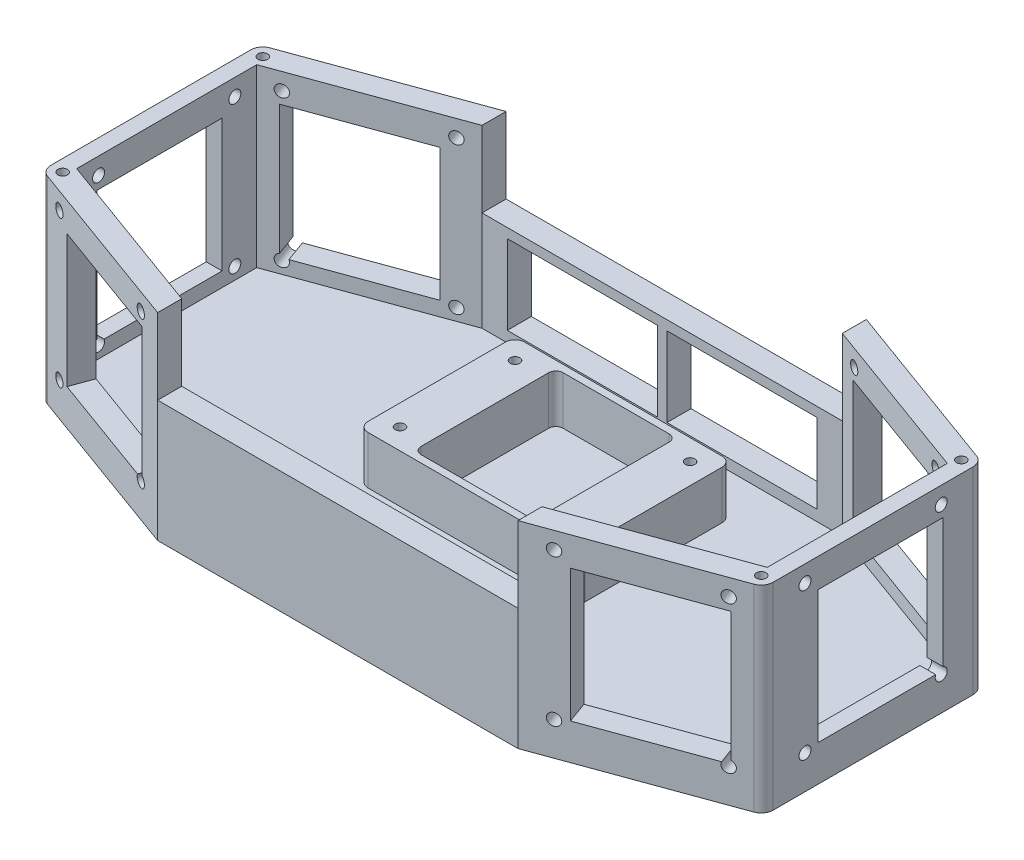
from build123d import *

# Parameters (mm, degrees)
BOSS_EXTRUDE1_DEPTH     = 8
SKETCH2_W               = 10.5
SKETCH2_H               = 10
BOSS_EXTRUDE2_DEPTH     = 37.5
SKETCH4_W               = 128.649180674
SKETCH4_H               = 10
BOSS_EXTRUDE4_DEPTH     = 4.5
BOSS_EXTRUDE5_DEPTH     = 10
SKETCH6_W               = 149.649180674
SKETCH6_H               = 10
BOSS_EXTRUDE6_DEPTH     = 4
CUT_EXTRUDE1_REACH      = 249.54
SKETCH7_R               = 2.5
MIRROR2_COPY_1_REACH    = 249.54
MIRROR2_COPY_1_SKETCH_R = 2.5
CUT_EXTRUDE2_REACH      = 314.548
SKETCH8_R               = 2.5
BOSS_EXTRUDE8_DEPTH     = 63
CUT_EXTRUDE3_REACH      = 257.708
SKETCH10_R              = 2.5
MIRROR5_COPY_1_REACH    = 257.708
MIRROR5_COPY_1_SKETCH_R = 2.5
CUT_EXTRUDE4_REACH      = 321.057
SKETCH11_R              = 2.5
SKETCH12_W              = 6.577848346
SKETCH12_H              = 46
BOSS_EXTRUDE9_DEPTH     = 12
BOSS_EXTRUDE10_DEPTH    = 20
SKETCH14_R              = 2
CUT_EXTRUDE5_DEPTH      = 10
SKETCH15_W              = 149.649180674
SKETCH15_H              = 10
BOSS_EXTRUDE11_DEPTH    = 41.5
SKETCH17_R              = 2
CUT_EXTRUDE6_DEPTH      = 10
ENL_V_START             = -2
ESQUISSE1_W             = 12
ESQUISSE1_H             = 42
ESQUISSE1_W_2           = 42
ESQUISSE1_H_2           = 12
ENL_V_MAT_EXTRU_1_DEPTH = 6
BOSS_EXTRU_1_DEPTH      = 1
CONG_1_R                = 5
ENL_V_MAT_EXTRU_2_DEPTH = 10
ESQUISSE5_W             = 52
ESQUISSE5_H             = 55
ENL_V_MAT_EXTRU_3_DEPTH = 10
ESQUISSE6_W             = 52
ESQUISSE6_H             = 55
ENL_V_MAT_EXTRU_4_DEPTH = 10
ESQUISSE7_W             = 52
ESQUISSE7_H             = 55
ENL_V_MAT_EXTRU_5_DEPTH = 10
ESQUISSE8_W             = 52
ESQUISSE8_H             = 55
ENL_V_MAT_EXTRU_6_DEPTH = 10
ESQUISSE9_W             = 52
ESQUISSE9_H             = 55
ENL_V_MAT_EXTRU_7_DEPTH = 10
BOSS_EXTRU_2_REACH      = 182.079
ESQUISSE11_W            = 4
ESQUISSE11_H            = 10


with BuildPart() as part:
    # Sketch1 → Boss-Extrude1 (new body)
    with BuildSketch(Plane(origin=(0, 0, 0), x_dir=(1, 0, 0), z_dir=(0, 1, 0))):
        Polygon((-150, 45), (-150, -45), (-74.824590337, -72.361611466), (74.824590337, -72.361611466), (150, -45), (150, 45), (74.824590337, 72.361611466), (-74.824590337, 72.361611466), align=None)
    extrude(amount=BOSS_EXTRUDE1_DEPTH)

    # Sketch2 → Boss-Extrude2 (add)
    with BuildSketch(Plane(origin=(0, 8, 0), x_dir=(1, 0, 0), z_dir=(0, 1, 0))):
        with Locations((69.574590337, 67.361611466)):
            Rectangle(SKETCH2_W, SKETCH2_H)
        with Locations((-69.574590337, 67.361611466)):
            Rectangle(SKETCH2_W, SKETCH2_H)
    extrude(amount=BOSS_EXTRUDE2_DEPTH)

    # Sketch4 → Boss-Extrude4 (add)
    with BuildSketch(Plane(origin=(0, 8, 0), x_dir=(1, 0, 0), z_dir=(0, 1, 0))):
        with Locations((0, 67.361611466)):
            Rectangle(SKETCH4_W, SKETCH4_H)
    extrude(amount=BOSS_EXTRUDE4_DEPTH)

    # Sketch5 → Boss-Extrude5 (add)
    with BuildSketch(Plane(origin=(0, 8, 0), x_dir=(1, 0, 0), z_dir=(0, 1, 0))):
        Polygon((-74.824590337, 62.361611466), (-87.040594407, 57.915349603), (-140.603073792, 38.420201433), (-143.422151654, 37.394141003), (-143.422151654, -37.394141003), (-140.603073792, -38.420201433), (-87.040594407, -57.915349603), (-74.824590337, -62.361611466), (-74.824590337, -72.361611466), (-150, -45), (-150, 45), (-74.824590337, 72.361611466), align=None)
        Polygon((150, 45), (150, -45), (74.824590337, -72.361611466), (74.824590337, -62.361611466), (87.040594407, -57.915349603), (140.603073792, -38.420201433), (143.422151654, -37.394141003), (143.422151654, 37.394141003), (140.603073792, 38.420201433), (87.040594407, 57.915349603), (74.824590337, 62.361611466), (74.824590337, 72.361611466), align=None)
    extrude(amount=BOSS_EXTRUDE5_DEPTH)

    # Sketch6 → Boss-Extrude6 (add)
    with BuildSketch(Plane(origin=(0, 45.5, 0), x_dir=(1, 0, 0), z_dir=(0, 1, 0))):
        with Locations((0, 67.361611466)):
            Rectangle(SKETCH6_W, SKETCH6_H)
    extrude(amount=BOSS_EXTRUDE6_DEPTH)

    # Sketch7 → Cut-Extrude1 (cut, up to next)
    with BuildSketch(Plane(origin=(32.009387984, 0, -87.945070697), x_dir=(-0.9396926207859068, 0, -0.3420201433256732), z_dir=(0.3420201433256732, 0, -0.9396926207859068)), mode=Mode.PRIVATE) as cut_extrude1_sk1:
        with Locations((-113.852986668, 13)):
            Circle(SKETCH7_R)
    cut_extrude1_tool1 = extrude(cut_extrude1_sk1.sketch, amount=-CUT_EXTRUDE1_REACH, mode=Mode.PRIVATE) & part.part
    # Sketch7 → Cut-Extrude1 (cut, up to next)
    with BuildSketch(Plane(origin=(32.009387984, 0, -87.945070697), x_dir=(-0.9396926207859068, 0, -0.3420201433256732), z_dir=(0.3420201433256732, 0, -0.9396926207859068)), mode=Mode.PRIVATE) as cut_extrude1_sk2:
        with Locations((-57.272986668, 13)):
            Circle(SKETCH7_R)
    cut_extrude1_tool2 = extrude(cut_extrude1_sk2.sketch, amount=-CUT_EXTRUDE1_REACH, mode=Mode.PRIVATE) & part.part
    cut_extrude1_1 = cut_extrude1_tool1.solids().sort_by_distance((138.996199, 13, -49.005056))[0]
    add(cut_extrude1_1, mode=Mode.SUBTRACT)
    cut_extrude1_2 = cut_extrude1_tool2.solids().sort_by_distance((85.828391, 13, -68.356556))[0]
    add(cut_extrude1_2, mode=Mode.SUBTRACT)
    cut_extrude1 = cut_extrude1_1 + cut_extrude1_2  # Cut-Extrude1 as one shape, for the pattern or mirror that repeats it

    # Mirror1: Cut-Extrude1 across plane
    add(cut_extrude1.mirror(Plane(origin=(0, 0, 0), x_dir=(0, 0, 1), z_dir=(1, 0, 0))), mode=Mode.SUBTRACT)

    # Mirror2: Cut-Extrude1 across plane
    add(cut_extrude1.mirror(Plane(origin=(0, 0, 0), x_dir=(1, 0, 0), z_dir=(0, 0, -1))), mode=Mode.SUBTRACT)

    # Mirror2 copy 1 sketch → Mirror2 copy 1 (cut, up to next)
    with BuildSketch(Plane(origin=(-32.009387984, 0, 87.945070697), x_dir=(0.9396926207859068, 0, 0.3420201433256732), z_dir=(-0.3420201433256732, 0, 0.9396926207859068)), mode=Mode.PRIVATE) as mirror2_copy_1_sk1:
        with Locations((-113.852986668, 13)):
            Circle(MIRROR2_COPY_1_SKETCH_R)
    mirror2_copy_1_tool1 = extrude(mirror2_copy_1_sk1.sketch, amount=-MIRROR2_COPY_1_REACH, mode=Mode.PRIVATE) & part.part
    # Mirror2 copy 1 sketch → Mirror2 copy 1 (cut, up to next)
    with BuildSketch(Plane(origin=(-32.009387984, 0, 87.945070697), x_dir=(0.9396926207859068, 0, 0.3420201433256732), z_dir=(-0.3420201433256732, 0, 0.9396926207859068)), mode=Mode.PRIVATE) as mirror2_copy_1_sk2:
        with Locations((-57.272986668, 13)):
            Circle(MIRROR2_COPY_1_SKETCH_R)
    mirror2_copy_1_tool2 = extrude(mirror2_copy_1_sk2.sketch, amount=-MIRROR2_COPY_1_REACH, mode=Mode.PRIVATE) & part.part
    add(mirror2_copy_1_tool1.solids().sort_by_distance((-138.996199, 13, 49.005056))[0], mode=Mode.SUBTRACT)
    add(mirror2_copy_1_tool2.solids().sort_by_distance((-85.828391, 13, 68.356556))[0], mode=Mode.SUBTRACT)

    # Sketch8 → Cut-Extrude2 (cut, up to next)
    with BuildSketch(Plane(origin=(150, 0, 0), x_dir=(0, 0, -1), z_dir=(1, 0, 0)), mode=Mode.PRIVATE) as cut_extrude2_sk1:
        with Locations((-28.29, 13)):
            Circle(SKETCH8_R)
    cut_extrude2_tool1 = extrude(cut_extrude2_sk1.sketch, amount=-CUT_EXTRUDE2_REACH, mode=Mode.PRIVATE) & part.part
    # Sketch8 → Cut-Extrude2 (cut, up to next)
    with BuildSketch(Plane(origin=(150, 0, 0), x_dir=(0, 0, -1), z_dir=(1, 0, 0)), mode=Mode.PRIVATE) as cut_extrude2_sk2:
        with Locations((28.29, 13)):
            Circle(SKETCH8_R)
    cut_extrude2_tool2 = extrude(cut_extrude2_sk2.sketch, amount=-CUT_EXTRUDE2_REACH, mode=Mode.PRIVATE) & part.part
    cut_extrude2_1 = cut_extrude2_tool1.solids().sort_by_distance((150, 13, 28.29))[0]
    add(cut_extrude2_1, mode=Mode.SUBTRACT)
    cut_extrude2_2 = cut_extrude2_tool2.solids().sort_by_distance((150, 13, -28.29))[0]
    add(cut_extrude2_2, mode=Mode.SUBTRACT)
    cut_extrude2 = cut_extrude2_1 + cut_extrude2_2  # Cut-Extrude2 as one shape, for the pattern or mirror that repeats it

    # Mirror3: Cut-Extrude2 across plane
    add(cut_extrude2.mirror(Plane(origin=(0, 0, 0), x_dir=(0, 0, 1), z_dir=(1, 0, 0))), mode=Mode.SUBTRACT)

    # Sketch9 → Boss-Extrude8 (add)
    with BuildSketch(Plane(origin=(0, 18, 0), x_dir=(1, 0, 0), z_dir=(0, 1, 0))):
        Polygon((143.422151654, 23), (150, 23), (150, 45), (134.025225447, 50.814342437), (130.811287398, 41.984120221), (143.422151654, 37.394141003), align=None)
        Polygon((74.824590337, 72.361611466), (90.79936489, 66.54726903), (87.585426842, 57.717046814), (74.824590337, 62.361611466), align=None)
        Polygon((-74.824590337, 62.361611466), (-74.824590337, 72.361611466), (-90.79936489, 66.54726903), (-87.585426842, 57.717046814), align=None)
        Polygon((-143.422151654, 37.394141003), (-143.422151654, 23), (-150, 23), (-150, 45), (-134.025225447, 50.814342437), (-130.811287398, 41.984120221), align=None)
        Polygon((143.422151654, -37.394141003), (143.422151654, -23), (150, -23), (150, -45), (134.025225447, -50.814342437), (130.811287398, -41.984120221), align=None)
        Polygon((-143.422151654, -23), (-150, -23), (-150, -45), (-134.025225447, -50.814342437), (-130.811287398, -41.984120221), (-143.422151654, -37.394141003), align=None)
        Polygon((-74.824590337, -72.361611466), (-90.79936489, -66.54726903), (-87.585426842, -57.717046814), (-74.824590337, -62.361611466), align=None)
        Polygon((74.824590337, -62.361611466), (74.824590337, -72.361611466), (90.79936489, -66.54726903), (87.585426842, -57.717046814), align=None)
    extrude(amount=BOSS_EXTRUDE8_DEPTH)

    # Sketch10 → Cut-Extrude3 (cut, up to next)
    with BuildSketch(Plane(origin=(32.009387984, 0, -87.945070697), x_dir=(-0.9396926207859068, 0, -0.3420201433256732), z_dir=(0.3420201433256732, 0, -0.9396926207859068)), mode=Mode.PRIVATE) as cut_extrude3_sk1:
        with Locations((-113.852986668, 74)):
            Circle(SKETCH10_R)
    cut_extrude3_tool1 = extrude(cut_extrude3_sk1.sketch, amount=-CUT_EXTRUDE3_REACH, mode=Mode.PRIVATE) & part.part
    # Sketch10 → Cut-Extrude3 (cut, up to next)
    with BuildSketch(Plane(origin=(32.009387984, 0, -87.945070697), x_dir=(-0.9396926207859068, 0, -0.3420201433256732), z_dir=(0.3420201433256732, 0, -0.9396926207859068)), mode=Mode.PRIVATE) as cut_extrude3_sk2:
        with Locations((-57.272986668, 74)):
            Circle(SKETCH10_R)
    cut_extrude3_tool2 = extrude(cut_extrude3_sk2.sketch, amount=-CUT_EXTRUDE3_REACH, mode=Mode.PRIVATE) & part.part
    cut_extrude3_1 = cut_extrude3_tool1.solids().sort_by_distance((138.996199, 74, -49.005056))[0]
    add(cut_extrude3_1, mode=Mode.SUBTRACT)
    cut_extrude3_2 = cut_extrude3_tool2.solids().sort_by_distance((85.828391, 74, -68.356556))[0]
    add(cut_extrude3_2, mode=Mode.SUBTRACT)
    cut_extrude3 = cut_extrude3_1 + cut_extrude3_2  # Cut-Extrude3 as one shape, for the pattern or mirror that repeats it

    # Mirror4: Cut-Extrude3 across plane
    add(cut_extrude3.mirror(Plane(origin=(0, 0, 0), x_dir=(0, 0, 1), z_dir=(1, 0, 0))), mode=Mode.SUBTRACT)

    # Mirror5: Cut-Extrude3 across plane
    add(cut_extrude3.mirror(Plane(origin=(0, 0, 0), x_dir=(1, 0, 0), z_dir=(0, 0, -1))), mode=Mode.SUBTRACT)

    # Mirror5 copy 1 sketch → Mirror5 copy 1 (cut, up to next)
    with BuildSketch(Plane(origin=(-32.009387984, 0, 87.945070697), x_dir=(0.9396926207859068, 0, 0.3420201433256732), z_dir=(-0.3420201433256732, 0, 0.9396926207859068)), mode=Mode.PRIVATE) as mirror5_copy_1_sk1:
        with Locations((-113.852986668, 74)):
            Circle(MIRROR5_COPY_1_SKETCH_R)
    mirror5_copy_1_tool1 = extrude(mirror5_copy_1_sk1.sketch, amount=-MIRROR5_COPY_1_REACH, mode=Mode.PRIVATE) & part.part
    # Mirror5 copy 1 sketch → Mirror5 copy 1 (cut, up to next)
    with BuildSketch(Plane(origin=(-32.009387984, 0, 87.945070697), x_dir=(0.9396926207859068, 0, 0.3420201433256732), z_dir=(-0.3420201433256732, 0, 0.9396926207859068)), mode=Mode.PRIVATE) as mirror5_copy_1_sk2:
        with Locations((-57.272986668, 74)):
            Circle(MIRROR5_COPY_1_SKETCH_R)
    mirror5_copy_1_tool2 = extrude(mirror5_copy_1_sk2.sketch, amount=-MIRROR5_COPY_1_REACH, mode=Mode.PRIVATE) & part.part
    add(mirror5_copy_1_tool1.solids().sort_by_distance((-138.996199, 74, 49.005056))[0], mode=Mode.SUBTRACT)
    add(mirror5_copy_1_tool2.solids().sort_by_distance((-85.828391, 74, 68.356556))[0], mode=Mode.SUBTRACT)

    # Sketch11 → Cut-Extrude4 (cut, up to next)
    with BuildSketch(Plane(origin=(150, 0, 0), x_dir=(0, 0, -1), z_dir=(1, 0, 0)), mode=Mode.PRIVATE) as cut_extrude4_sk1:
        with Locations((-28.29, 74)):
            Circle(SKETCH11_R)
    cut_extrude4_tool1 = extrude(cut_extrude4_sk1.sketch, amount=-CUT_EXTRUDE4_REACH, mode=Mode.PRIVATE) & part.part
    # Sketch11 → Cut-Extrude4 (cut, up to next)
    with BuildSketch(Plane(origin=(150, 0, 0), x_dir=(0, 0, -1), z_dir=(1, 0, 0)), mode=Mode.PRIVATE) as cut_extrude4_sk2:
        with Locations((28.29, 74)):
            Circle(SKETCH11_R)
    cut_extrude4_tool2 = extrude(cut_extrude4_sk2.sketch, amount=-CUT_EXTRUDE4_REACH, mode=Mode.PRIVATE) & part.part
    cut_extrude4_1 = cut_extrude4_tool1.solids().sort_by_distance((150, 74, 28.29))[0]
    add(cut_extrude4_1, mode=Mode.SUBTRACT)
    cut_extrude4_2 = cut_extrude4_tool2.solids().sort_by_distance((150, 74, -28.29))[0]
    add(cut_extrude4_2, mode=Mode.SUBTRACT)
    cut_extrude4 = cut_extrude4_1 + cut_extrude4_2  # Cut-Extrude4 as one shape, for the pattern or mirror that repeats it

    # Mirror6: Cut-Extrude4 across plane
    add(cut_extrude4.mirror(Plane(origin=(0, 0, 0), x_dir=(0, 0, 1), z_dir=(1, 0, 0))), mode=Mode.SUBTRACT)

    # Sketch12 → Boss-Extrude9 (add)
    with BuildSketch(Plane(origin=(0, 81, 0), x_dir=(1, 0, 0), z_dir=(0, 1, 0))):
        Polygon((130.811287398, 41.984120221), (87.585426842, 57.717046814), (90.79936489, 66.54726903), (134.025225447, 50.814342437), align=None)
        with Locations((146.711075827, 0)):
            Rectangle(SKETCH12_W, SKETCH12_H)
        Polygon((134.025225447, -50.814342437), (130.811287398, -41.984120221), (87.585426842, -57.717046814), (90.79936489, -66.54726903), align=None)
        Polygon((-130.811287398, -41.984120221), (-87.585426842, -57.717046814), (-90.79936489, -66.54726903), (-134.025225447, -50.814342437), align=None)
        with Locations((-146.711075827, 0)):
            Rectangle(SKETCH12_W, SKETCH12_H)
        Polygon((-134.025225447, 50.814342437), (-130.811287398, 41.984120221), (-87.585426842, 57.717046814), (-90.79936489, 66.54726903), align=None)
    extrude(amount=-BOSS_EXTRUDE9_DEPTH)

    # Sketch13 → Boss-Extrude10 (add)
    with BuildSketch(Plane(origin=(0, 8, 0), x_dir=(1, 0, 0), z_dir=(0, 1, 0))):
        with BuildLine():
            Line((-41, 46.231611466), (-29, 46.231611466))
            Line((-29, 46.231611466), (29, 46.231611466))
            Line((29, 46.231611466), (41, 46.231611466))
            ThreePointArc((41, 46.231611466), (43.828427125, 45.060038591), (45, 42.231611466))
            Line((45, 42.231611466), (45, -14.768388534))
            ThreePointArc((45, -14.768388534), (43.828427125, -17.596815659), (41, -18.768388534))
            Line((41, -18.768388534), (29, -18.768388534))
            Line((29, -18.768388534), (-29, -18.768388534))
            Line((-29, -18.768388534), (-41, -18.768388534))
            ThreePointArc((-41, -18.768388534), (-43.828427125, -17.596815659), (-45, -14.768388534))
            Line((-45, -14.768388534), (-45, 42.231611466))
            ThreePointArc((-45, 42.231611466), (-43.828427125, 45.060038591), (-41, 46.231611466))
        make_face()
        with BuildLine():
            Line((-25, 40.231611466), (-25, -12.768388534))
            ThreePointArc((-25, -12.768388534), (-24.121320344, -14.889708878), (-22, -15.768388534))
            Line((-22, -15.768388534), (22, -15.768388534))
            ThreePointArc((22, -15.768388534), (24.121320344, -14.889708878), (25, -12.768388534))
            Line((25, -12.768388534), (25, 40.231611466))
            ThreePointArc((25, 40.231611466), (24.121320344, 42.35293181), (22, 43.231611466))
            Line((22, 43.231611466), (-22, 43.231611466))
            ThreePointArc((-22, 43.231611466), (-24.121320344, 42.35293181), (-25, 40.231611466))
        make_face(mode=Mode.SUBTRACT)
    extrude(amount=BOSS_EXTRUDE10_DEPTH)

    # Sketch14 → Cut-Extrude5 (cut)
    with BuildSketch(Plane(origin=(0, 28, 0), x_dir=(1, 0, 0), z_dir=(0, 1, 0))):
        with Locations((-36.37, 37.606611466)):
            Circle(SKETCH14_R)
        with Locations((-36.37, -10.143388534)):
            Circle(SKETCH14_R)
    cut_extrude5 = extrude(amount=-CUT_EXTRUDE5_DEPTH, mode=Mode.SUBTRACT)

    # Mirror7: Cut-Extrude5 across plane
    add(cut_extrude5.mirror(Plane(origin=(0, 0, 0), x_dir=(0, 0, 1), z_dir=(1, 0, 0))), mode=Mode.SUBTRACT)

    # Sketch15 → Boss-Extrude11 (add)
    with BuildSketch(Plane(origin=(0, 8, 0), x_dir=(1, 0, 0), z_dir=(0, 1, 0))):
        with Locations((0, -67.361611466)):
            Rectangle(SKETCH15_W, SKETCH15_H)
    extrude(amount=BOSS_EXTRUDE11_DEPTH)

    # Sketch17 → Cut-Extrude6 (cut)
    with BuildSketch(Plane(origin=(0, 81, 0), x_dir=(1, 0, 0), z_dir=(0, 1, 0))):
        with Locations((145.085087734, -41.558541382)):
            Circle(SKETCH17_R)
        with Locations((145.085087734, 41.558541382)):
            Circle(SKETCH17_R)
        with Locations((-145.085087734, 41.558541382)):
            Circle(SKETCH17_R)
        with Locations((-145.085087734, -41.558541382)):
            Circle(SKETCH17_R)
    extrude(amount=-CUT_EXTRUDE6_DEPTH, mode=Mode.SUBTRACT)

    # Esquisse1 → Enlèv. mat.-Extru.1 (cut)
    with BuildSketch(Plane(origin=(0, 8, 0), x_dir=(1, 0, 0), z_dir=(0, 1, 0)).offset(ENL_V_START)):
        with Locations((-126, 0)):
            Rectangle(ESQUISSE1_W, ESQUISSE1_H)
        with Locations((126, 0)):
            Rectangle(ESQUISSE1_W, ESQUISSE1_H)
        with Locations((-74.824590337, 25)):
            Rectangle(ESQUISSE1_W_2, ESQUISSE1_H_2)
        with Locations((-74.824590337, -25)):
            Rectangle(ESQUISSE1_W_2, ESQUISSE1_H_2)
        with Locations((74.824590337, -25)):
            Rectangle(ESQUISSE1_W_2, ESQUISSE1_H_2)
        with Locations((74.824590337, 25)):
            Rectangle(ESQUISSE1_W_2, ESQUISSE1_H_2)
    extrude(amount=-ENL_V_MAT_EXTRU_1_DEPTH, mode=Mode.SUBTRACT)

    # Esquisse2 → Boss.-Extru.1 (add)
    with BuildSketch(Plane.XZ):
        Polygon((-150, -45), (-74.824590337, -72.361611466), (74.824590337, -72.361611466), (150, -45), (150, 45), (74.824590337, 72.361611466), (-74.824590337, 72.361611466), (-150, 45), align=None)
    extrude(amount=BOSS_EXTRU_1_DEPTH)

    # Congé1
    cong_1_edges = [part.edges().sort_by_distance(p)[0] for p in [
        (150, 40, 45),
        (150, 40, -45),
        (-150, 40, -45),
        (-150, 40, 45),
    ]]
    fillet(cong_1_edges, radius=CONG_1_R)

    # Esquisse3 → Enlèv. mat.-Extru.2 (cut)
    with BuildSketch(Plane(origin=(-32.009387984, 0, 87.945070697), x_dir=(0.9396926207859068, 0, 0.34202014332567315), z_dir=(-0.34202014332567315, 0, 0.9396926207859069))):
        with BuildLine():
            Line((-56.562986668, 69), (-62.562986668, 69))
            Line((-62.562986668, 69), (-62.562986668, 18))
            Line((-62.562986668, 18), (-108.562986668, 18))
            Line((-108.562986668, 18), (-108.562986668, 14))
            Line((-108.562986668, 14), (-59.564274516, 14))
            ThreePointArc((-59.564274516, 14), (-58.328004424, 15.266481312), (-56.562986668, 15.3970607))
            Line((-56.562986668, 15.3970607), (-56.562986668, 69))
        make_face()
    extrude(amount=-ENL_V_MAT_EXTRU_2_DEPTH, mode=Mode.SUBTRACT)

    # Esquisse5 → Enlèv. mat.-Extru.3 (cut)
    with BuildSketch(Plane.ZY.offset(150)):
        with Locations((3, 41.5)):
            Rectangle(ESQUISSE5_W, ESQUISSE5_H)
    extrude(amount=-ENL_V_MAT_EXTRU_3_DEPTH, mode=Mode.SUBTRACT)

    # Esquisse6 → Enlèv. mat.-Extru.4 (cut)
    with BuildSketch(Plane(origin=(-32.009387984, 0, -87.945070697), x_dir=(-0.9396926207859068, 0, 0.34202014332567315), z_dir=(-0.34202014332567315, 0, -0.9396926207859069))):
        with Locations((88.562986668, 41.5)):
            Rectangle(ESQUISSE6_W, ESQUISSE6_H)
    extrude(amount=-ENL_V_MAT_EXTRU_4_DEPTH, mode=Mode.SUBTRACT)

    # Esquisse7 → Enlèv. mat.-Extru.5 (cut)
    with BuildSketch(Plane(origin=(32.009387984, 0, -87.945070697), x_dir=(-0.9396926207859068, 0, -0.3420201433256732), z_dir=(0.3420201433256732, 0, -0.9396926207859068))):
        with Locations((-82.562986668, 41.5)):
            Rectangle(ESQUISSE7_W, ESQUISSE7_H)
    extrude(amount=-ENL_V_MAT_EXTRU_5_DEPTH, mode=Mode.SUBTRACT)

    # Esquisse8 → Enlèv. mat.-Extru.6 (cut)
    with BuildSketch(Plane(origin=(150, 0, 0), x_dir=(0, 0, -1), z_dir=(1, 0, 0))):
        with Locations((3, 41.5)):
            Rectangle(ESQUISSE8_W, ESQUISSE8_H)
    extrude(amount=-ENL_V_MAT_EXTRU_6_DEPTH, mode=Mode.SUBTRACT)

    # Esquisse9 → Enlèv. mat.-Extru.7 (cut)
    with BuildSketch(Plane(origin=(32.009387984, 0, 87.945070697), x_dir=(0.9396926207859068, 0, -0.3420201433256732), z_dir=(0.3420201433256732, 0, 0.9396926207859068))):
        with Locations((88.562986668, 41.5)):
            Rectangle(ESQUISSE9_W, ESQUISSE9_H)
    extrude(amount=-ENL_V_MAT_EXTRU_7_DEPTH, mode=Mode.SUBTRACT)

    # Esquisse11 → Boss.-Extru.2 (add, up to next)
    with BuildSketch(Plane(origin=(0, 12.5, 0), x_dir=(1, 0, 0), z_dir=(0, 1, 0)), mode=Mode.PRIVATE) as boss_extru_2_sk1:
        with Locations((0, 67.361611466)):
            Rectangle(ESQUISSE11_W, ESQUISSE11_H)
    boss_extru_2_tool1 = extrude(boss_extru_2_sk1.sketch, amount=BOSS_EXTRU_2_REACH, mode=Mode.PRIVATE) - part.part
    add(boss_extru_2_tool1.solids().sort_by_distance((0, 12.5, -67.361611))[0])


solid = part.part
